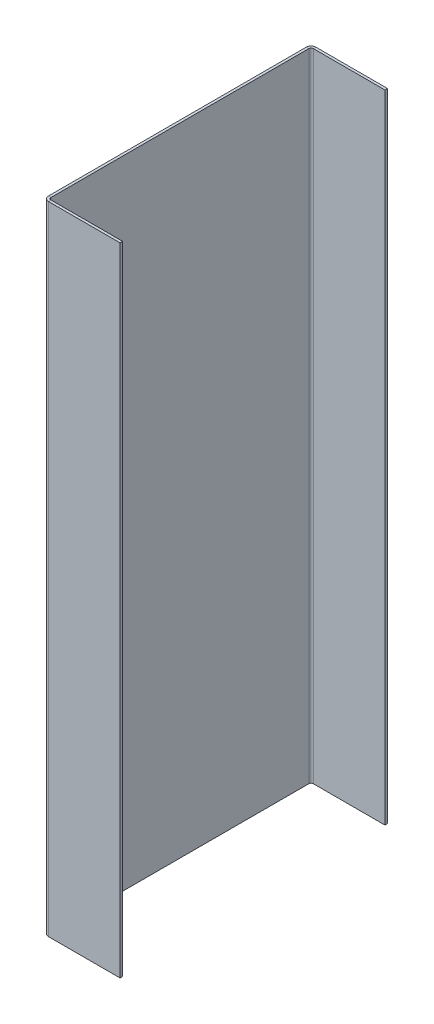
from build123d import *

# Parameters (mm, degrees)
SKETCH_1_W                         = 2
SKETCH_1_H                         = 500
SM_BASE_FLANGE_1_DEPTH             = 210
SM_EDGE_FLANGE_1_STRIP_W           = 11.6
SM_EDGE_FLANGE_1_STRIP_H           = 2
SM_EDGE_FLANGE_1_STRIP_CUT_DEPTH   = 500
SM_EDGE_FLANGE_1_STRIP_2_W         = 11.6
SM_EDGE_FLANGE_1_STRIP_2_H         = 2
SM_EDGE_FLANGE_1_STRIP_CUT_2_DEPTH = 500
SM_EDGE_FLANGE_1_DEPTH             = 500
SM_EDGE_FLANGE_1_BEND_DEPTH        = 500


# Sheet-metal steps are written as plain solids
with BuildPart() as part:
    # Sketch 1 → Базовая кромка1 (new body)
    with BuildSketch(Plane.XY):
        with Locations((1, 250)):
            Rectangle(SKETCH_1_W, SKETCH_1_H)
    extrude(amount=SM_BASE_FLANGE_1_DEPTH)

    # Ребро-кромка1 strip (across the edge) → Ребро-кромка1 strip cut (cut)
    with BuildSketch(Plane(origin=(2, 0, 0), x_dir=(0, 0, 1), z_dir=(0, 1, 0))):
        with Locations((-2, -1)):
            Rectangle(SM_EDGE_FLANGE_1_STRIP_W, SM_EDGE_FLANGE_1_STRIP_H)
    extrude(amount=SM_EDGE_FLANGE_1_STRIP_CUT_DEPTH, mode=Mode.SUBTRACT)

    # Ребро-кромка1 strip 2 (across the edge) → Ребро-кромка1 strip cut 2 (cut)
    with BuildSketch(Plane(origin=(2, 500, 210), x_dir=(0, 0, -1), z_dir=(0, -1, 0))):
        with Locations((-2, -1)):
            Rectangle(SM_EDGE_FLANGE_1_STRIP_2_W, SM_EDGE_FLANGE_1_STRIP_2_H)
    extrude(amount=SM_EDGE_FLANGE_1_STRIP_CUT_2_DEPTH, mode=Mode.SUBTRACT)

    # Ребро-кромка1 section (across the edge) → Ребро-кромка1 (add)
    with BuildSketch(Plane(origin=(2, 0, 0), x_dir=(0, 0, 1), z_dir=(0, 1, 0))):
        with BuildLine():
            Line((0, 1.8), (0, 58))
            Line((0, 58), (2, 58))
            Line((2, 58), (2, 1.8))
            ThreePointArc((2, 1.8), (2.527207794, 0.527207794), (3.8, 0))
            Line((3.8, 0), (3.8, -2))
            ThreePointArc((3.8, -2), (1.112994231, -0.887005769), (0, 1.8))
        make_face()
    extrude(amount=SM_EDGE_FLANGE_1_DEPTH)

    # Ребро-кромка1 section 2 (across the edge) → Ребро-кромка1 bend (add)
    with BuildSketch(Plane(origin=(2, 500, 210), x_dir=(0, 0, -1), z_dir=(0, -1, 0))):
        with BuildLine():
            Line((0, 1.8), (0, 58))
            Line((0, 58), (2, 58))
            Line((2, 58), (2, 1.8))
            ThreePointArc((2, 1.8), (2.527207794, 0.527207794), (3.8, 0))
            Line((3.8, 0), (3.8, -2))
            ThreePointArc((3.8, -2), (1.112994231, -0.887005769), (0, 1.8))
        make_face()
    extrude(amount=SM_EDGE_FLANGE_1_BEND_DEPTH)


solid = part.part
